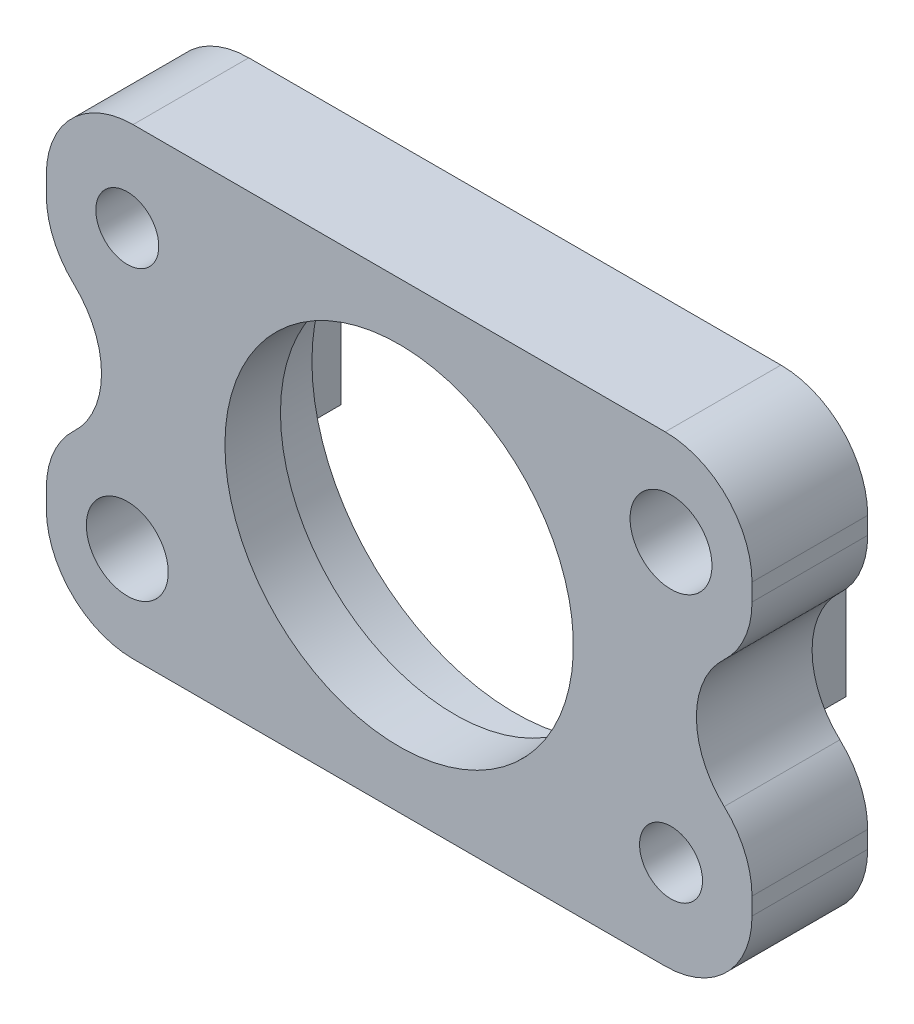
from build123d import *

# Parameters (mm, degrees)
SKETCH1_W                       = 38.735
SKETCH1_H                       = 25.4
BOSS_EXTRUDE1_DEPTH             = 6.35
CUT_EXTRUDE1_DEPTH              = 257.920089717
CUT_EXTRUDE2_DEPTH              = 257.920089717
SKETCH4_W                       = 2.286
SKETCH4_H                       = 8.89
BOSS_EXTRUDE2_DEPTH             = 3.175
SKETCH5_W                       = 2.286
SKETCH5_H                       = 8.89
BOSS_EXTRUDE3_DEPTH             = 3.175
HOLE1_D                         = 19.1262
HOLE1_CBORE_D                   = 22.2758
HOLE1_CBORE_DEPTH               = 3.302
F_16_0_177_DIAMETER_HOLE1_D     = 4.4958
F_16_0_177_DIAMETER_HOLE1_DEPTH = 9.525
F_29_0_136_DIAMETER_HOLE1_D     = 3.4544
F_29_0_136_DIAMETER_HOLE1_DEPTH = 9.525
FILLET1_R                       = 4.7625


with BuildPart() as part:
    # Sketch1 → Boss-Extrude1 (new body)
    with BuildSketch(Plane.XY.offset(6.35)):
        with Locations((-234.6325, 25.4)):
            Rectangle(SKETCH1_W, SKETCH1_H)
    extrude(amount=-BOSS_EXTRUDE1_DEPTH)

    # Sketch2 → Cut-Extrude1 (cut, through all)
    with BuildSketch(Plane(origin=(0, 0, 0), x_dir=(-1, 0, 0), z_dir=(0, 0, -1))):
        with BuildLine():
            Line((215.265, 32.388210744), (215.265, 18.411789256))
            ThreePointArc((215.265, 18.411789256), (215.6632391, 20.318260617), (216.791355087, 21.905894628))
            ThreePointArc((216.791355087, 21.905894628), (218.317710174, 25.4), (216.791355087, 28.894105372))
            ThreePointArc((216.791355087, 28.894105372), (215.6632391, 30.481739383), (215.265, 32.388210744))
        make_face()
    extrude(amount=-CUT_EXTRUDE1_DEPTH, mode=Mode.SUBTRACT)

    # Sketch3 → Cut-Extrude2 (cut, through all)
    with BuildSketch(Plane(origin=(0, 0, 0), x_dir=(-1, 0, 0), z_dir=(0, 0, -1))):
        with BuildLine():
            Line((254, 20.955), (254, 29.845))
            ThreePointArc((254, 29.845), (250.969652441, 25.4), (254, 20.955))
        make_face()
    extrude(amount=-CUT_EXTRUDE2_DEPTH, mode=Mode.SUBTRACT)

    # Sketch4 → Boss-Extrude2 (add)
    with BuildSketch(Plane(origin=(0, 0, 0), x_dir=(-1, 0, 0), z_dir=(0, 0, -1))):
        with Locations((220.7641, 25.4)):
            Rectangle(SKETCH4_W, SKETCH4_H)
    extrude(amount=BOSS_EXTRUDE2_DEPTH)

    # Sketch5 → Boss-Extrude3 (add)
    with BuildSketch(Plane(origin=(0, 0, 0), x_dir=(-1, 0, 0), z_dir=(0, 0, -1))):
        with Locations((248.5009, 25.4)):
            Rectangle(SKETCH5_W, SKETCH5_H)
    extrude(amount=BOSS_EXTRUDE3_DEPTH)

    # Hole1 (through all)
    with Locations(Plane(origin=(0, 0, 0), x_dir=(-1, 0, 0), z_dir=(0, 0, -1))):
        with Locations((234.6325, 25.4)):
            CounterBoreHole(HOLE1_D / 2, HOLE1_CBORE_D / 2, HOLE1_CBORE_DEPTH)

    # #16 (0.177) Diameter Hole1
    with Locations(Plane.XY.offset(6.35)):
        with Locations((-249.555, 17.78), (-219.71, 33.02)):
            Hole(F_16_0_177_DIAMETER_HOLE1_D / 2, depth=F_16_0_177_DIAMETER_HOLE1_DEPTH)

    # #29 (0.136) Diameter Hole1
    with Locations(Plane.XY.offset(6.35)):
        with Locations((-219.71, 17.78), (-249.555, 33.02)):
            Hole(F_29_0_136_DIAMETER_HOLE1_D / 2, depth=F_29_0_136_DIAMETER_HOLE1_DEPTH)

    # Fillet1
    fillet1_edges = [part.edges().sort_by_distance(p)[0] for p in [
        (-254, 20.955, 3.175),
        (-254, 29.845, 3.175),
        (-215.265, 12.7, 3.175),
        (-254, 12.7, 3.175),
        (-215.265, 38.1, 3.175),
        (-254, 38.1, 3.175),
    ]]
    fillet(fillet1_edges, radius=FILLET1_R)


solid = part.part
